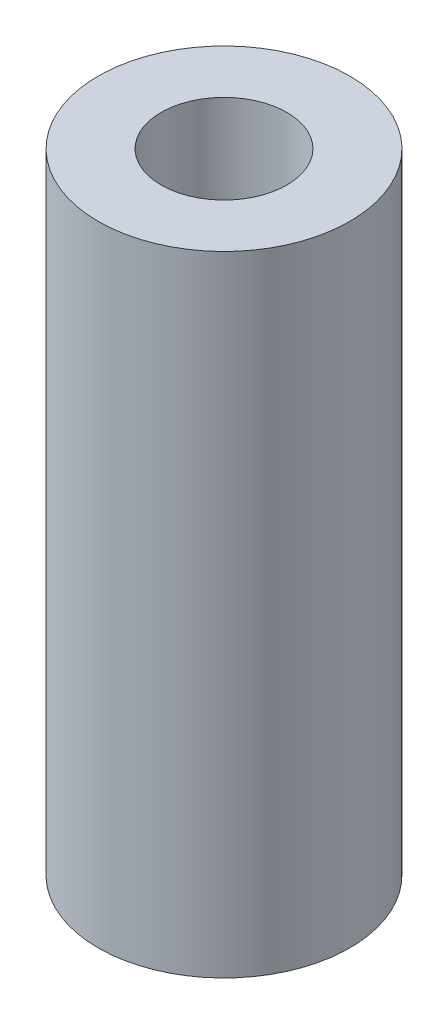
from build123d import *

# Parameters (mm, degrees)
SKETCH1_R           = 1
SKETCH1_R_2         = 0.5
BOSS_EXTRUDE1_DEPTH = 5
SCALE1_SCALE        = 6


with BuildPart() as part:
    # Sketch1 → Boss-Extrude1 (new body)
    with BuildSketch(Plane(origin=(0, 0, 0), x_dir=(1, 0, 0), z_dir=(0, 1, 0))):
        Circle(SKETCH1_R)
        Circle(SKETCH1_R_2, mode=Mode.SUBTRACT)
    extrude(amount=BOSS_EXTRUDE1_DEPTH)


with BuildPart() as part_1:
    # Scale1: scaled about (0, 2.5, 0)
    add(part.part.scale(SCALE1_SCALE).moved(Location((0, -12.5, 0))))


solid = part_1.part
